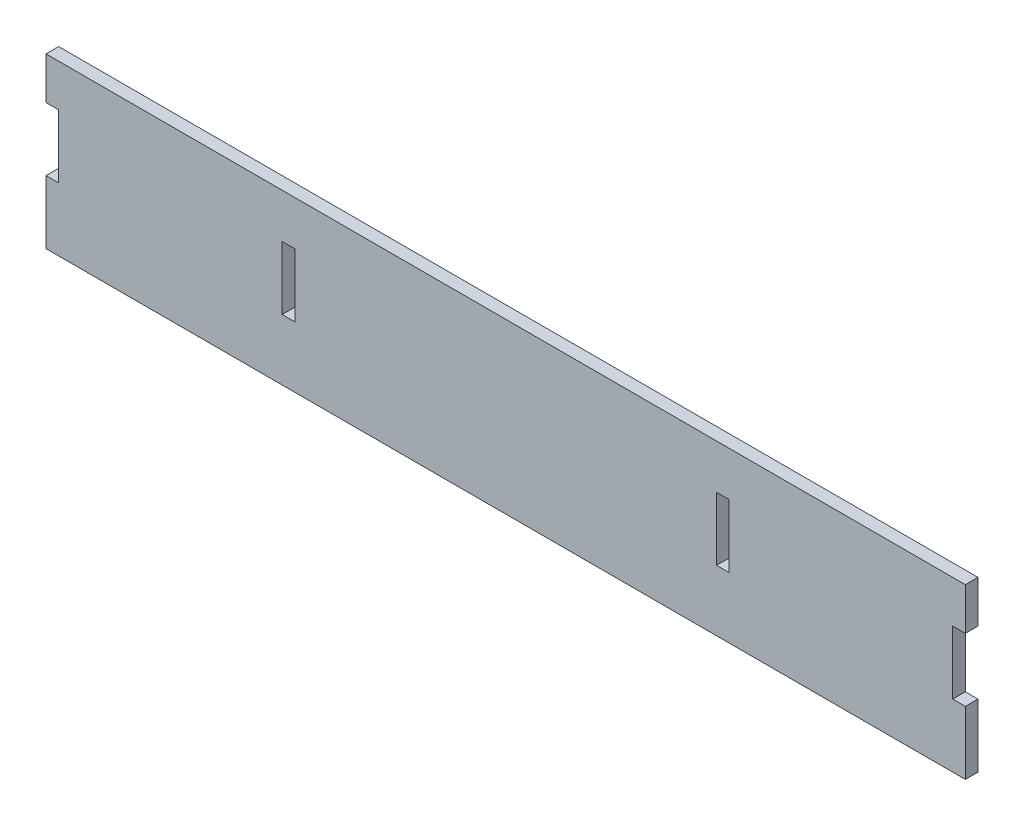
from build123d import *

# Parameters (mm, degrees)
SKETCH1_W           = 3
SKETCH1_H           = 15
BOSS_EXTRUDE1_DEPTH = 3


with BuildPart() as part:
    # Sketch1 → Boss-Extrude1 (new body)
    with BuildSketch(Plane.XY):
        Polygon((218, 30), (218, 40), (0, 40), (0, 30), (3, 30), (3, 15), (0, 15), (0, 0), (218, 0), (218, 15), (215, 15), (215, 30), align=None)
        with Locations((57.5, 21.97224362)):
            Rectangle(SKETCH1_W, SKETCH1_H, mode=Mode.SUBTRACT)
        with Locations((160.5, 21.97224362)):
            Rectangle(SKETCH1_W, SKETCH1_H, mode=Mode.SUBTRACT)
    extrude(amount=BOSS_EXTRUDE1_DEPTH)


solid = part.part
